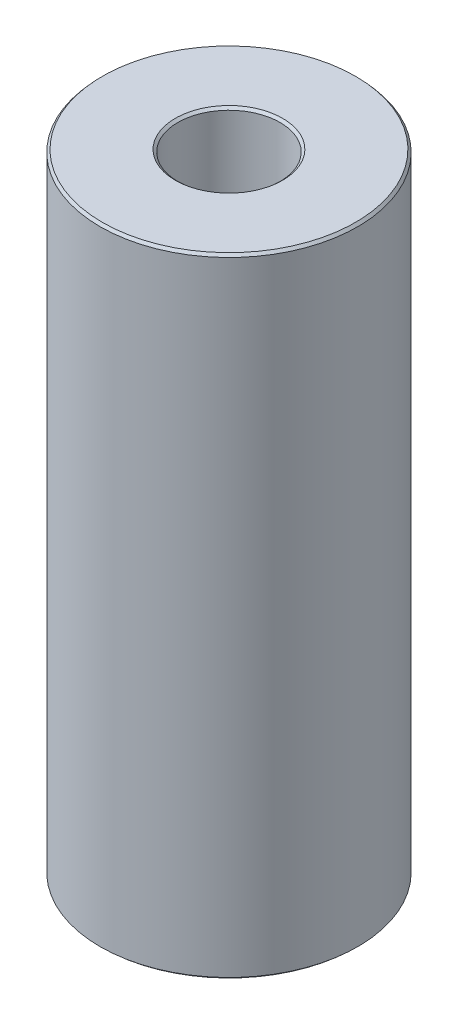
from build123d import *
from OCP.BRepFilletAPI import BRepFilletAPI_MakeChamfer

# Parameters (mm, degrees)
SKETCH1_R           = 55
BOSS_EXTRUDE1_DEPTH = 268.233558865
SKETCH2_R           = 21.819560222
CUT_EXTRUDE1_DEPTH  = 280.283444016
CHAMFER1_SIZE       = 1.103064888
CHAMFER1_SIZE2      = 0.973628519


with BuildPart() as part:
    # Sketch1 → Boss-Extrude1 (new body)
    with BuildSketch(Plane(origin=(0, 0, 0), x_dir=(1, 0, 0), z_dir=(0, 1, 0))):
        Circle(SKETCH1_R)
    extrude(amount=BOSS_EXTRUDE1_DEPTH)

    # Sketch2 → Cut-Extrude1 (cut, through all)
    with BuildSketch(Plane(origin=(0, 0, 0), x_dir=(1, 0, 0), z_dir=(0, 1, 0))):
        Circle(SKETCH2_R)
    extrude(amount=CUT_EXTRUDE1_DEPTH, mode=Mode.SUBTRACT)

    # Chamfer1: one chamfer whose edges measure the first distance from different faces: ONE call of the kernel's chamfer builder (chamfer() names one face for all edges)
    chamfer1_edges_1 = [part.edges().sort_by_distance(p)[0] for p in [
        (-21.819560222, 268.233558865, 0),
    ]]
    chamfer1_side_1 = [part.faces().sort_by_distance(p)[0] for p in [
        (-53.444365081, 268.233558865, 0),
    ]]
    chamfer1_edges_2 = [part.edges().sort_by_distance(p)[0] for p in [
        (-21.819560222, 0, 0),
    ]]
    chamfer1_side_2 = [part.faces().sort_by_distance(p)[0] for p in [
        (-21.819560222, 134.116779433, 0),
    ]]
    chamfer1_edges_3 = [part.edges().sort_by_distance(p)[0] for p in [
        (-55, 0, 0),
    ]]
    chamfer1_side_3 = [part.faces().sort_by_distance(p)[0] for p in [
        (-53.444365081, 0, 0),
    ]]
    chamfer1_edges_4 = [part.edges().sort_by_distance(p)[0] for p in [
        (-55, 268.233558865, 0),
    ]]
    chamfer1_side_4 = [part.faces().sort_by_distance(p)[0] for p in [
        (-55, 134.116779433, 0),
    ]]
    chamfer1 = BRepFilletAPI_MakeChamfer(part.part.solid().wrapped)
    for e in chamfer1_edges_1:
        chamfer1.Add(CHAMFER1_SIZE, CHAMFER1_SIZE2, e.wrapped, chamfer1_side_1[0].wrapped)  # the first distance lies on this face
    for e in chamfer1_edges_2:
        chamfer1.Add(CHAMFER1_SIZE, CHAMFER1_SIZE2, e.wrapped, chamfer1_side_2[0].wrapped)  # the first distance lies on this face
    for e in chamfer1_edges_3:
        chamfer1.Add(CHAMFER1_SIZE, CHAMFER1_SIZE2, e.wrapped, chamfer1_side_3[0].wrapped)  # the first distance lies on this face
    for e in chamfer1_edges_4:
        chamfer1.Add(CHAMFER1_SIZE, CHAMFER1_SIZE2, e.wrapped, chamfer1_side_4[0].wrapped)  # the first distance lies on this face
    add(Compound.cast(chamfer1.Shape()), mode=Mode.REPLACE)


solid = part.part
